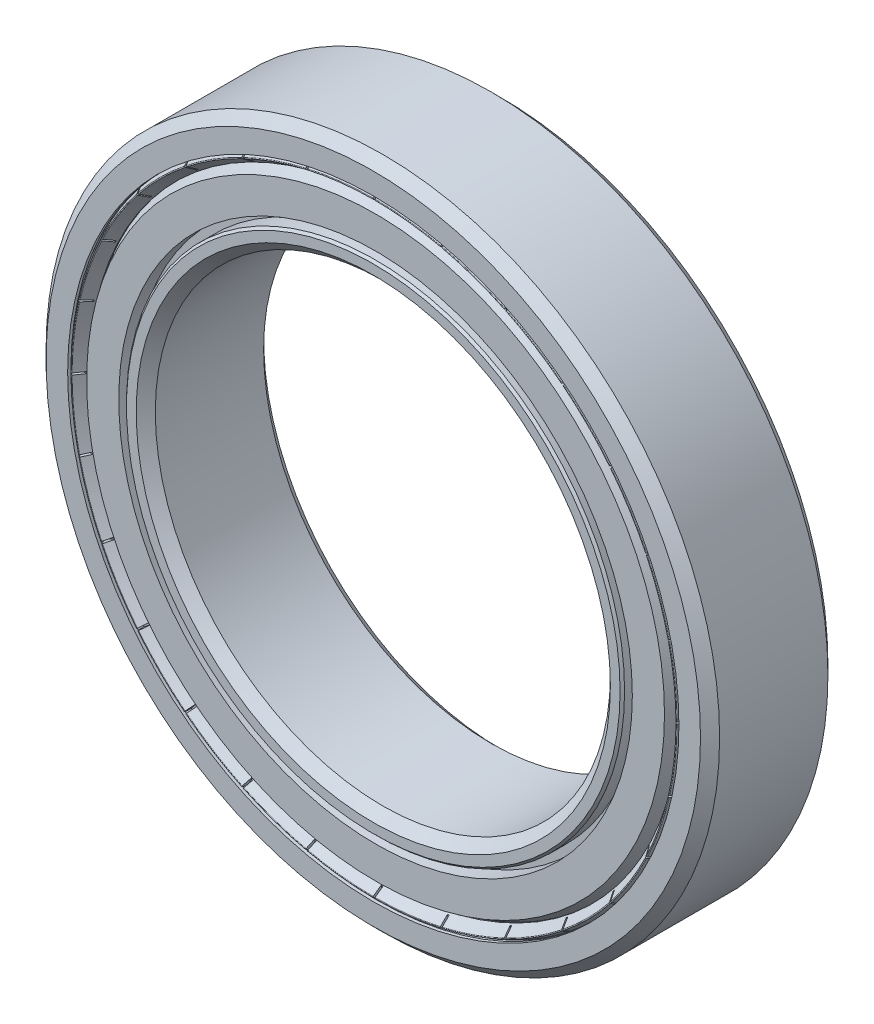
from build123d import *

# Parameters (mm, degrees)
CIRPATTERN1_COUNT  = 14
FILLET1_R          = 0.035
CUT_EXTRUDE1_START = 2.995758
CUT_EXTRUDE1_DEPTH = 24.400264428
CIRPATTERN2_COUNT  = 28


with BuildPart() as part:
    # Sketch3 → Revolve1 (revolve)
    with BuildSketch(Plane(origin=(0, 0, 0), x_dir=(0, 0, -1), z_dir=(1, 0, 0)), mode=Mode.PRIVATE) as revolve1_sk:
        with BuildLine():
            Line((2.975, 18.5), (-2.975, 18.5))
            Line((-2.975, 18.5), (-3.5, 17.975))
            Line((-3.5, 17.975), (-3.5, 16.789819322))
            Line((-3.5, 16.789819322), (-3.325, 16.789819322))
            Line((-3.325, 16.789819322), (-3.325, 17.194909661))
            Line((-3.325, 17.194909661), (-3.201256313, 17.318653348))
            Line((-3.201256313, 17.318653348), (-1.05, 17.318653348))
            ThreePointArc((-1.05, 17.318653348), (0, 17.6), (1.05, 17.318653348))
            Line((1.05, 17.318653348), (3.201256313, 17.318653348))
            Line((3.201256313, 17.318653348), (3.325, 17.194909661))
            Line((3.325, 17.194909661), (3.325, 16.789819322))
            Line((3.325, 16.789819322), (3.5, 16.789819322))
            Line((3.5, 16.789819322), (3.5, 17.975))
            Line((3.5, 17.975), (2.975, 18.5))
        make_face()
        with BuildLine():
            Line((2.975, 12.5), (-2.975, 12.5))
            Line((-2.975, 12.5), (-3.5, 13.025))
            Line((-3.5, 13.025), (-3.5, 13.557602965))
            Line((-3.5, 13.557602965), (-3.376256313, 13.681346652))
            Line((-3.376256313, 13.681346652), (-1.05, 13.681346652))
            ThreePointArc((-1.05, 13.681346652), (0, 13.4), (1.05, 13.681346652))
            Line((1.05, 13.681346652), (3.376256313, 13.681346652))
            Line((3.376256313, 13.681346652), (3.5, 13.557602965))
            Line((3.5, 13.557602965), (3.5, 13.025))
            Line((3.5, 13.025), (2.975, 12.5))
        make_face()
    revolve(revolve1_sk.sketch.rotate(Axis((0, 0, 3.5), (0, 0, -1)), 90), axis=Axis((0, 0, 3.5), (0, 0, -1)))


with BuildPart() as body_2:
    # Sketch4 → Revolve2 (revolve)
    with BuildSketch(Plane(origin=(0, 0, 0), x_dir=(0, 0, -1), z_dir=(1, 0, 0))):
        with BuildLine():
            Line((0, 17.6), (0, 13.4))
            ThreePointArc((0, 13.4), (-2.1, 15.5), (0, 17.6))
        make_face()
    revolve(axis=Axis((0, 18.5, 0), (0, -1, 0)))


with BuildPart() as cirpattern1_1:
    # CirPattern1: pattern copy
    add(body_2.part.rotate(Axis((0, 0, 0), (0, 0, 1)), 1 * 360 / CIRPATTERN1_COUNT))


with BuildPart() as cirpattern1_2:
    # CirPattern1: pattern copy
    add(body_2.part.rotate(Axis((0, 0, 0), (0, 0, 1)), 2 * 360 / CIRPATTERN1_COUNT))


with BuildPart() as cirpattern1_3:
    # CirPattern1: pattern copy
    add(body_2.part.rotate(Axis((0, 0, 0), (0, 0, 1)), 3 * 360 / CIRPATTERN1_COUNT))


with BuildPart() as cirpattern1_4:
    # CirPattern1: pattern copy
    add(body_2.part.rotate(Axis((0, 0, 0), (0, 0, 1)), 4 * 360 / CIRPATTERN1_COUNT))


with BuildPart() as cirpattern1_5:
    # CirPattern1: pattern copy
    add(body_2.part.rotate(Axis((0, 0, 0), (0, 0, 1)), 5 * 360 / CIRPATTERN1_COUNT))


with BuildPart() as cirpattern1_6:
    # CirPattern1: pattern copy
    add(body_2.part.rotate(Axis((0, 0, 0), (0, 0, 1)), 6 * 360 / CIRPATTERN1_COUNT))


with BuildPart() as cirpattern1_7:
    # CirPattern1: pattern copy
    add(body_2.part.rotate(Axis((0, 0, 0), (0, 0, 1)), 7 * 360 / CIRPATTERN1_COUNT))


with BuildPart() as cirpattern1_8:
    # CirPattern1: pattern copy
    add(body_2.part.rotate(Axis((0, 0, 0), (0, 0, 1)), 8 * 360 / CIRPATTERN1_COUNT))


with BuildPart() as cirpattern1_9:
    # CirPattern1: pattern copy
    add(body_2.part.rotate(Axis((0, 0, 0), (0, 0, 1)), 9 * 360 / CIRPATTERN1_COUNT))


with BuildPart() as cirpattern1_10:
    # CirPattern1: pattern copy
    add(body_2.part.rotate(Axis((0, 0, 0), (0, 0, 1)), 10 * 360 / CIRPATTERN1_COUNT))


with BuildPart() as cirpattern1_11:
    # CirPattern1: pattern copy
    add(body_2.part.rotate(Axis((0, 0, 0), (0, 0, 1)), 11 * 360 / CIRPATTERN1_COUNT))


with BuildPart() as cirpattern1_12:
    # CirPattern1: pattern copy
    add(body_2.part.rotate(Axis((0, 0, 0), (0, 0, 1)), 12 * 360 / CIRPATTERN1_COUNT))


with BuildPart() as cirpattern1_13:
    # CirPattern1: pattern copy
    add(body_2.part.rotate(Axis((0, 0, 0), (0, 0, 1)), 13 * 360 / CIRPATTERN1_COUNT))


with BuildPart() as body_16:
    # Sketch5 → Revolve3 (revolve)
    with BuildSketch(Plane(origin=(0, 0, 0), x_dir=(0, 0, -1), z_dir=(1, 0, 0)), mode=Mode.PRIVATE) as revolve3_sk:
        Polygon((-2.1, 13.681346652), (-2.525418771, 13.681346652), (-2.525418771, 14.106765423), (-3.376256313, 14.106765423), (-3.376256313, 15.873169267), (-2.525418771, 16.364400551), (-2.1, 16.364400551), align=None)
        Polygon((2.525418771, 16.364400551), (2.1, 16.364400551), (2.1, 13.681346652), (2.525418771, 13.681346652), (2.525418771, 14.106765423), (3.376256313, 14.106765423), (3.376256313, 15.873169267), align=None)
    revolve(revolve3_sk.sketch.rotate(Axis((0, 0, 3.5), (0, 0, -1)), 90), axis=Axis((0, 0, 3.5), (0, 0, -1)))


with BuildPart() as body_17:
    # Sketch6 → Revolve4 (revolve)
    with BuildSketch(Plane(origin=(0, 0, 0), x_dir=(0, 0, -1), z_dir=(1, 0, 0)), mode=Mode.PRIVATE) as revolve4_sk:
        Polygon((-2.797765893, 16.789819322), (-3.19375, 16.789819322), (-3.5, 16.613005803), (-2.902765893, 16.194817979), (-2.867765893, 16.194817979), (-2.797765893, 16.207160867), align=None)
    revolve(revolve4_sk.sketch.rotate(Axis((0, 0, 3.5), (0, 0, -1)), 90), axis=Axis((0, 0, 3.5), (0, 0, -1)))

    # Fillet1
    fillet1_edges = [body_17.edges().sort_by_distance(p)[0] for p in [
        (-16.613005803, 0, 3.5),
    ]]
    fillet(fillet1_edges, radius=FILLET1_R)

    # Sketch7 → Cut-Extrude1 (cut, through all)
    with BuildSketch(Plane.XY.offset(CUT_EXTRUDE1_START)):
        Polygon((-0.05, 16.789819322), (-0.05, 16.889819322), (0.05, 16.889819322), (0.05, 16.789819322), (0.05, 16.194817979), (0.05, 16.094817979), (-0.05, 16.094817979), (-0.05, 16.194817979), align=None)
    cut_extrude1 = extrude(amount=CUT_EXTRUDE1_DEPTH, mode=Mode.SUBTRACT)

    # CirPattern2: Cut-Extrude1 ×28 about axis
    cirpattern2_axis = Axis((0, 0, 0), (0, 0, 1))
    for i in range(1, CIRPATTERN2_COUNT):
        add(cut_extrude1.rotate(cirpattern2_axis, i * 360 / CIRPATTERN2_COUNT), mode=Mode.SUBTRACT)


with BuildPart() as body_18:
    # Mirror1: mirrored copy
    add(body_17.part.mirror(Plane.XY))


solid = Compound([part.part, body_2.part, cirpattern1_1.part, cirpattern1_2.part, cirpattern1_3.part, cirpattern1_4.part, cirpattern1_5.part, cirpattern1_6.part, cirpattern1_7.part, cirpattern1_8.part, cirpattern1_9.part, cirpattern1_10.part, cirpattern1_11.part, cirpattern1_12.part, cirpattern1_13.part, body_16.part, body_17.part, body_18.part])
